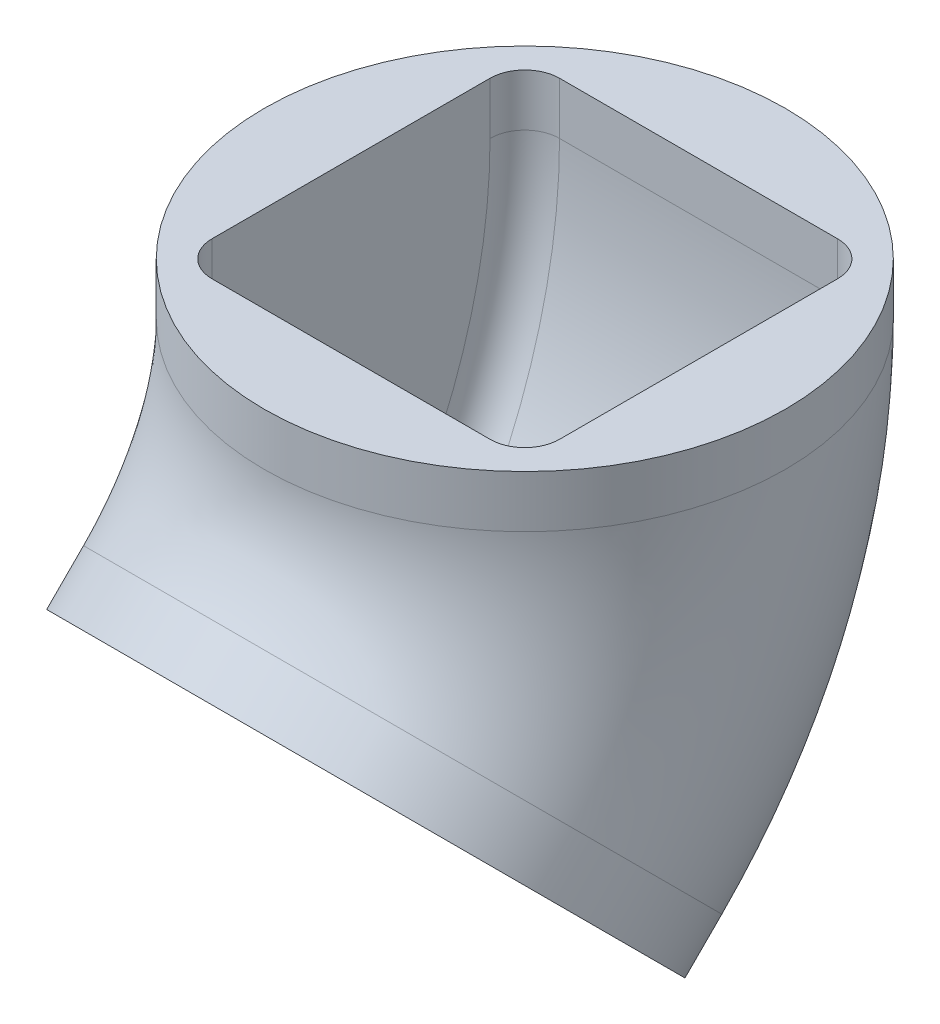
from build123d import *

# Parameters (mm, degrees)
CROQUIS1_R              = 75
CROQUIS1_W              = 100
CROQUIS1_H              = 100
SALIENTE_EXTRUIR1_DEPTH = 15
REDONDEO1_R             = 10
BARRER1_OUTLINE_R       = 75
BARRER1_ANGLE           = 45
CROQUIS6_R              = 75
CROQUIS6_R_2            = 63
SALIENTE_EXTRUIR3_DEPTH = 15


# Read off the part's stored shape, not the designer's step: Barrer1
with BuildPart() as part:
    # Croquis1 → Saliente-Extruir1 (new body)
    with BuildSketch(Plane(origin=(0, 0, 0), x_dir=(1, 0, 0), z_dir=(0, 1, 0))):
        with Locations(Location((0, 0, 0), (0, 0, 270))):
            Circle(CROQUIS1_R)
        Rectangle(CROQUIS1_W, CROQUIS1_H, mode=Mode.SUBTRACT)
    extrude(amount=SALIENTE_EXTRUIR1_DEPTH)

    # Redondeo1
    redondeo1_edges = [part.edges().sort_by_distance(p)[0] for p in [
        (50, 7.5, 50),
        (50, 7.5, -50),
        (-50, 7.5, -50),
        (-50, 7.5, 50),
    ]]
    fillet(redondeo1_edges, radius=REDONDEO1_R)

    # Barrer1 outline → Barrer1 (revolve)
    with BuildSketch(Plane(origin=(0, 0, 120), x_dir=(0, -0.7071067811865493, -0.7071067811865457), z_dir=(0, -0.7071067811865457, 0.7071067811865493))):
        with Locations((120, 0)):
            Circle(BARRER1_OUTLINE_R)
        with BuildLine():
            Line((80, 50), (160, 50))
            ThreePointArc((160, 50), (167.071067812, 47.071067812), (170, 40))
            Line((170, 40), (170, -40))
            ThreePointArc((170, -40), (167.071067812, -47.071067812), (160, -50))
            Line((160, -50), (80, -50))
            ThreePointArc((80, -50), (72.928932188, -47.071067812), (70, -40))
            Line((70, -40), (70, 40))
            ThreePointArc((70, 40), (72.928932188, 47.071067812), (80, 50))
        make_face(mode=Mode.SUBTRACT)
    revolve(axis=Axis((0, 0, 120), (1, 0, 0)), revolution_arc=BARRER1_ANGLE)

    # Croquis6 → Saliente-Extruir3 (add)
    with BuildSketch(Plane(origin=(0, -60, 60), x_dir=(1, 0, 0), z_dir=(0, -0.7071067811865467, 0.7071067811865485))):
        with Locations(Location((0, -35.147186258, 0), (0, 0, 270))):
            Circle(CROQUIS6_R)
        with Locations(Location((0, -35.147186258, 0), (0, 0, 52.528004817))):
            Circle(CROQUIS6_R_2, mode=Mode.SUBTRACT)
    extrude(amount=SALIENTE_EXTRUIR3_DEPTH)


solid = part.part
